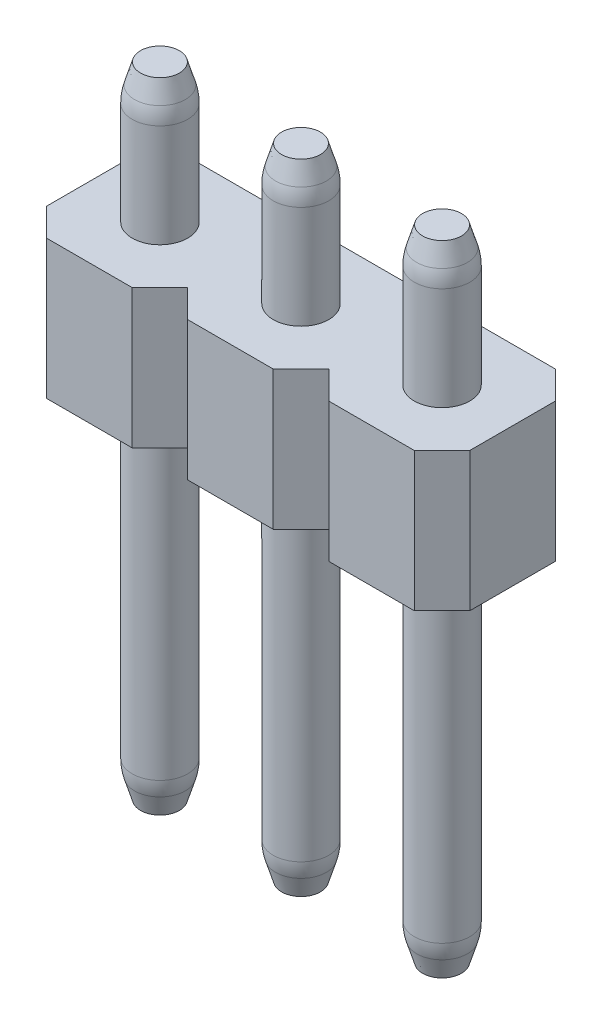
from build123d import *
from OCP.BRepFilletAPI import BRepFilletAPI_MakeChamfer

# Parameters (mm, degrees)
SKETCH1_R               = 0.5
BOSS_EXTRUDE1_DEPTH     = 11.5
BOSS_EXTRUDE1_2_DEPTH   = 11.5
BOSS_EXTRUDE1_3_DEPTH   = 11.5
BOSS_EXTRUDE1_4_DEPTH   = 11.5
BOSS_EXTRUDE1_5_DEPTH   = 11.5
BOSS_EXTRUDE1_6_DEPTH   = 11.5
BOSS_EXTRUDE1_7_DEPTH   = 11.5
BOSS_EXTRUDE1_8_DEPTH   = 11.5
BOSS_EXTRUDE1_9_DEPTH   = 11.5
BOSS_EXTRUDE1_10_DEPTH  = 11.5
BOSS_EXTRUDE1_11_DEPTH  = 11.5
BOSS_EXTRUDE1_12_DEPTH  = 11.5
BOSS_EXTRUDE1_13_DEPTH  = 11.5
BOSS_EXTRUDE1_14_DEPTH  = 11.5
BOSS_EXTRUDE1_15_DEPTH  = 11.5
BOSS_EXTRUDE1_16_DEPTH  = 11.5
BOSS_EXTRUDE2_DEPTH     = 2.5
CHAMFER1_SIZE           = 0.5
CHAMFER1_SIZE2          = 0.15
FILLET1_R               = 1
CHAMFER2_SIZE           = 0.15
CHAMFER2_SIZE2          = 0.5
FILLET2_R               = 1
CUT_EXTRUDE1_DEPTH      = 42.093776929
CUT_EXTRUDE1_DEPTH_BACK = 42.093776929


with BuildPart() as part:
    # Sketch1 → Boss-Extrude1 (new body)
    with BuildSketch(Plane(origin=(0, 0, 0), x_dir=(1, 0, 0), z_dir=(0, 1, 0))):
        Circle(SKETCH1_R)
    extrude(amount=BOSS_EXTRUDE1_DEPTH)



with BuildPart() as body_2:
    # Sketch1 → Boss-Extrude1 2 (new body)
    with BuildSketch(Plane(origin=(0, 0, 0), x_dir=(1, 0, 0), z_dir=(0, 1, 0))):
        with Locations((2.54, 0)):
            Circle(SKETCH1_R)
    extrude(amount=BOSS_EXTRUDE1_2_DEPTH)


with BuildPart() as body_3:
    # Sketch1 → Boss-Extrude1 3 (new body)
    with BuildSketch(Plane(origin=(0, 0, 0), x_dir=(1, 0, 0), z_dir=(0, 1, 0))):
        with Locations((5.08, 0)):
            Circle(SKETCH1_R)
    extrude(amount=BOSS_EXTRUDE1_3_DEPTH)


with BuildPart() as body_4:
    # Sketch1 → Boss-Extrude1 4 (new body)
    with BuildSketch(Plane(origin=(0, 0, 0), x_dir=(1, 0, 0), z_dir=(0, 1, 0))):
        with Locations((7.62, 0)):
            Circle(SKETCH1_R)
    extrude(amount=BOSS_EXTRUDE1_4_DEPTH)


with BuildPart() as body_5:
    # Sketch1 → Boss-Extrude1 5 (new body)
    with BuildSketch(Plane(origin=(0, 0, 0), x_dir=(1, 0, 0), z_dir=(0, 1, 0))):
        with Locations((10.16, 0)):
            Circle(SKETCH1_R)
    extrude(amount=BOSS_EXTRUDE1_5_DEPTH)


with BuildPart() as body_6:
    # Sketch1 → Boss-Extrude1 6 (new body)
    with BuildSketch(Plane(origin=(0, 0, 0), x_dir=(1, 0, 0), z_dir=(0, 1, 0))):
        with Locations((12.7, 0)):
            Circle(SKETCH1_R)
    extrude(amount=BOSS_EXTRUDE1_6_DEPTH)


with BuildPart() as body_7:
    # Sketch1 → Boss-Extrude1 7 (new body)
    with BuildSketch(Plane(origin=(0, 0, 0), x_dir=(1, 0, 0), z_dir=(0, 1, 0))):
        with Locations((15.24, 0)):
            Circle(SKETCH1_R)
    extrude(amount=BOSS_EXTRUDE1_7_DEPTH)


with BuildPart() as body_8:
    # Sketch1 → Boss-Extrude1 8 (new body)
    with BuildSketch(Plane(origin=(0, 0, 0), x_dir=(1, 0, 0), z_dir=(0, 1, 0))):
        with Locations((17.78, 0)):
            Circle(SKETCH1_R)
    extrude(amount=BOSS_EXTRUDE1_8_DEPTH)


with BuildPart() as body_9:
    # Sketch1 → Boss-Extrude1 9 (new body)
    with BuildSketch(Plane(origin=(0, 0, 0), x_dir=(1, 0, 0), z_dir=(0, 1, 0))):
        with Locations((20.32, 0)):
            Circle(SKETCH1_R)
    extrude(amount=BOSS_EXTRUDE1_9_DEPTH)


with BuildPart() as body_10:
    # Sketch1 → Boss-Extrude1 10 (new body)
    with BuildSketch(Plane(origin=(0, 0, 0), x_dir=(1, 0, 0), z_dir=(0, 1, 0))):
        with Locations((22.86, 0)):
            Circle(SKETCH1_R)
    extrude(amount=BOSS_EXTRUDE1_10_DEPTH)


with BuildPart() as body_11:
    # Sketch1 → Boss-Extrude1 11 (new body)
    with BuildSketch(Plane(origin=(0, 0, 0), x_dir=(1, 0, 0), z_dir=(0, 1, 0))):
        with Locations((25.4, 0)):
            Circle(SKETCH1_R)
    extrude(amount=BOSS_EXTRUDE1_11_DEPTH)


with BuildPart() as body_12:
    # Sketch1 → Boss-Extrude1 12 (new body)
    with BuildSketch(Plane(origin=(0, 0, 0), x_dir=(1, 0, 0), z_dir=(0, 1, 0))):
        with Locations((27.94, 0)):
            Circle(SKETCH1_R)
    extrude(amount=BOSS_EXTRUDE1_12_DEPTH)


with BuildPart() as body_13:
    # Sketch1 → Boss-Extrude1 13 (new body)
    with BuildSketch(Plane(origin=(0, 0, 0), x_dir=(1, 0, 0), z_dir=(0, 1, 0))):
        with Locations((30.48, 0)):
            Circle(SKETCH1_R)
    extrude(amount=BOSS_EXTRUDE1_13_DEPTH)


with BuildPart() as body_14:
    # Sketch1 → Boss-Extrude1 14 (new body)
    with BuildSketch(Plane(origin=(0, 0, 0), x_dir=(1, 0, 0), z_dir=(0, 1, 0))):
        with Locations((33.02, 0)):
            Circle(SKETCH1_R)
    extrude(amount=BOSS_EXTRUDE1_14_DEPTH)


with BuildPart() as body_15:
    # Sketch1 → Boss-Extrude1 15 (new body)
    with BuildSketch(Plane(origin=(0, 0, 0), x_dir=(1, 0, 0), z_dir=(0, 1, 0))):
        with Locations((35.56, 0)):
            Circle(SKETCH1_R)
    extrude(amount=BOSS_EXTRUDE1_15_DEPTH)


with BuildPart() as body_16:
    # Sketch1 → Boss-Extrude1 16 (new body)
    with BuildSketch(Plane(origin=(0, 0, 0), x_dir=(1, 0, 0), z_dir=(0, 1, 0))):
        with Locations((38.1, 0)):
            Circle(SKETCH1_R)
    extrude(amount=BOSS_EXTRUDE1_16_DEPTH)


with BuildPart() as part_1:
    add(part.part)

    add(body_2.part)  # Boss-Extrude2 merges body 2

    add(body_3.part)  # Boss-Extrude2 merges body 3

    add(body_4.part)  # Boss-Extrude2 merges body 4

    add(body_5.part)  # Boss-Extrude2 merges body 5

    add(body_6.part)  # Boss-Extrude2 merges body 6

    add(body_7.part)  # Boss-Extrude2 merges body 7

    add(body_8.part)  # Boss-Extrude2 merges body 8

    add(body_9.part)  # Boss-Extrude2 merges body 9

    add(body_10.part)  # Boss-Extrude2 merges body 10

    add(body_11.part)  # Boss-Extrude2 merges body 11

    add(body_12.part)  # Boss-Extrude2 merges body 12

    add(body_13.part)  # Boss-Extrude2 merges body 13

    add(body_14.part)  # Boss-Extrude2 merges body 14

    add(body_15.part)  # Boss-Extrude2 merges body 15

    add(body_16.part)  # Boss-Extrude2 merges body 16
    # Sketch2 → Boss-Extrude2 (add)
    with BuildSketch(Plane(origin=(0, 6.5, 0), x_dir=(1, 0, 0), z_dir=(0, 1, 0))):
        Polygon((-1.27, 0.77), (-0.77, 1.27), (0.77, 1.27), (1.27, 0.77), (1.77, 1.27), (3.31, 1.27), (3.81, 0.77), (4.31, 1.27), (5.85, 1.27), (6.35, 0.77), (6.85, 1.27), (8.39, 1.27), (8.89, 0.77), (9.39, 1.27), (10.93, 1.27), (11.43, 0.77), (11.93, 1.27), (13.47, 1.27), (13.97, 0.77), (14.47, 1.27), (16.01, 1.27), (16.51, 0.77), (17.01, 1.27), (18.55, 1.27), (19.05, 0.77), (19.55, 1.27), (21.09, 1.27), (21.59, 0.77), (22.09, 1.27), (23.63, 1.27), (24.13, 0.77), (24.63, 1.27), (26.17, 1.27), (26.67, 0.77), (27.17, 1.27), (28.71, 1.27), (29.21, 0.77), (29.71, 1.27), (31.25, 1.27), (31.75, 0.77), (32.25, 1.27), (33.79, 1.27), (34.29, 0.77), (34.79, 1.27), (36.33, 1.27), (36.83, 0.77), (37.33, 1.27), (38.87, 1.27), (39.37, 0.77), (39.37, -0.77), (38.87, -1.27), (37.33, -1.27), (36.83, -0.77), (36.33, -1.27), (34.79, -1.27), (34.29, -0.77), (33.79, -1.27), (32.25, -1.27), (31.75, -0.77), (31.25, -1.27), (29.71, -1.27), (29.21, -0.77), (28.71, -1.27), (27.17, -1.27), (26.67, -0.77), (26.17, -1.27), (24.63, -1.27), (24.13, -0.77), (23.63, -1.27), (22.09, -1.27), (21.59, -0.77), (21.09, -1.27), (19.55, -1.27), (19.05, -0.77), (18.55, -1.27), (17.01, -1.27), (16.51, -0.77), (16.01, -1.27), (14.47, -1.27), (13.97, -0.77), (13.47, -1.27), (11.93, -1.27), (11.43, -0.77), (10.93, -1.27), (9.39, -1.27), (8.89, -0.77), (8.39, -1.27), (6.85, -1.27), (6.35, -0.77), (5.85, -1.27), (4.31, -1.27), (3.81, -0.77), (3.31, -1.27), (1.77, -1.27), (1.27, -0.77), (0.77, -1.27), (-0.77, -1.27), (-1.27, -0.77), align=None)
    extrude(amount=BOSS_EXTRUDE2_DEPTH)

    # Chamfer1: one chamfer whose edges measure the first distance from different faces: ONE call of the kernel's chamfer builder (chamfer() names one face for all edges)
    chamfer1_edges_1 = [part_1.edges().sort_by_distance(p)[0] for p in [
        (14.74, 11.5, 0),
    ]]
    chamfer1_side_1 = [part_1.faces().sort_by_distance(p)[0] for p in [
        (14.74, 10.25, 0),
    ]]
    chamfer1_edges_2 = [part_1.edges().sort_by_distance(p)[0] for p in [
        (12.2, 11.5, 0),
    ]]
    chamfer1_side_2 = [part_1.faces().sort_by_distance(p)[0] for p in [
        (12.2, 10.25, 0),
    ]]
    chamfer1_edges_3 = [part_1.edges().sort_by_distance(p)[0] for p in [
        (9.66, 11.5, 0),
    ]]
    chamfer1_side_3 = [part_1.faces().sort_by_distance(p)[0] for p in [
        (9.66, 10.25, 0),
    ]]
    chamfer1_edges_4 = [part_1.edges().sort_by_distance(p)[0] for p in [
        (7.12, 11.5, 0),
    ]]
    chamfer1_side_4 = [part_1.faces().sort_by_distance(p)[0] for p in [
        (7.12, 10.25, 0),
    ]]
    chamfer1_edges_5 = [part_1.edges().sort_by_distance(p)[0] for p in [
        (4.58, 11.5, 0),
    ]]
    chamfer1_side_5 = [part_1.faces().sort_by_distance(p)[0] for p in [
        (4.58, 10.25, 0),
    ]]
    chamfer1_edges_6 = [part_1.edges().sort_by_distance(p)[0] for p in [
        (2.04, 11.5, 0),
    ]]
    chamfer1_side_6 = [part_1.faces().sort_by_distance(p)[0] for p in [
        (2.04, 10.25, 0),
    ]]
    chamfer1_edges_7 = [part_1.edges().sort_by_distance(p)[0] for p in [
        (-0.5, 11.5, 0),
    ]]
    chamfer1_side_7 = [part_1.faces().sort_by_distance(p)[0] for p in [
        (-0.5, 10.25, 0),
    ]]
    chamfer1_edges_8 = [part_1.edges().sort_by_distance(p)[0] for p in [
        (37.6, 11.5, 0),
    ]]
    chamfer1_side_8 = [part_1.faces().sort_by_distance(p)[0] for p in [
        (37.6, 10.25, 0),
    ]]
    chamfer1_edges_9 = [part_1.edges().sort_by_distance(p)[0] for p in [
        (35.06, 11.5, 0),
    ]]
    chamfer1_side_9 = [part_1.faces().sort_by_distance(p)[0] for p in [
        (35.06, 10.25, 0),
    ]]
    chamfer1_edges_10 = [part_1.edges().sort_by_distance(p)[0] for p in [
        (32.52, 11.5, 0),
    ]]
    chamfer1_side_10 = [part_1.faces().sort_by_distance(p)[0] for p in [
        (32.52, 10.25, 0),
    ]]
    chamfer1_edges_11 = [part_1.edges().sort_by_distance(p)[0] for p in [
        (29.98, 11.5, 0),
    ]]
    chamfer1_side_11 = [part_1.faces().sort_by_distance(p)[0] for p in [
        (29.98, 10.25, 0),
    ]]
    chamfer1_edges_12 = [part_1.edges().sort_by_distance(p)[0] for p in [
        (27.44, 11.5, 0),
    ]]
    chamfer1_side_12 = [part_1.faces().sort_by_distance(p)[0] for p in [
        (27.44, 10.25, 0),
    ]]
    chamfer1_edges_13 = [part_1.edges().sort_by_distance(p)[0] for p in [
        (24.9, 11.5, 0),
    ]]
    chamfer1_side_13 = [part_1.faces().sort_by_distance(p)[0] for p in [
        (24.9, 10.25, 0),
    ]]
    chamfer1_edges_14 = [part_1.edges().sort_by_distance(p)[0] for p in [
        (22.36, 11.5, 0),
    ]]
    chamfer1_side_14 = [part_1.faces().sort_by_distance(p)[0] for p in [
        (22.36, 10.25, 0),
    ]]
    chamfer1_edges_15 = [part_1.edges().sort_by_distance(p)[0] for p in [
        (19.82, 11.5, 0),
    ]]
    chamfer1_side_15 = [part_1.faces().sort_by_distance(p)[0] for p in [
        (19.82, 10.25, 0),
    ]]
    chamfer1_edges_16 = [part_1.edges().sort_by_distance(p)[0] for p in [
        (17.28, 11.5, 0),
    ]]
    chamfer1_side_16 = [part_1.faces().sort_by_distance(p)[0] for p in [
        (17.28, 10.25, 0),
    ]]
    chamfer1 = BRepFilletAPI_MakeChamfer(part_1.part.solid().wrapped)
    for e in chamfer1_edges_1:
        chamfer1.Add(CHAMFER1_SIZE, CHAMFER1_SIZE2, e.wrapped, chamfer1_side_1[0].wrapped)  # the first distance lies on this face
    for e in chamfer1_edges_2:
        chamfer1.Add(CHAMFER1_SIZE, CHAMFER1_SIZE2, e.wrapped, chamfer1_side_2[0].wrapped)  # the first distance lies on this face
    for e in chamfer1_edges_3:
        chamfer1.Add(CHAMFER1_SIZE, CHAMFER1_SIZE2, e.wrapped, chamfer1_side_3[0].wrapped)  # the first distance lies on this face
    for e in chamfer1_edges_4:
        chamfer1.Add(CHAMFER1_SIZE, CHAMFER1_SIZE2, e.wrapped, chamfer1_side_4[0].wrapped)  # the first distance lies on this face
    for e in chamfer1_edges_5:
        chamfer1.Add(CHAMFER1_SIZE, CHAMFER1_SIZE2, e.wrapped, chamfer1_side_5[0].wrapped)  # the first distance lies on this face
    for e in chamfer1_edges_6:
        chamfer1.Add(CHAMFER1_SIZE, CHAMFER1_SIZE2, e.wrapped, chamfer1_side_6[0].wrapped)  # the first distance lies on this face
    for e in chamfer1_edges_7:
        chamfer1.Add(CHAMFER1_SIZE, CHAMFER1_SIZE2, e.wrapped, chamfer1_side_7[0].wrapped)  # the first distance lies on this face
    for e in chamfer1_edges_8:
        chamfer1.Add(CHAMFER1_SIZE, CHAMFER1_SIZE2, e.wrapped, chamfer1_side_8[0].wrapped)  # the first distance lies on this face
    for e in chamfer1_edges_9:
        chamfer1.Add(CHAMFER1_SIZE, CHAMFER1_SIZE2, e.wrapped, chamfer1_side_9[0].wrapped)  # the first distance lies on this face
    for e in chamfer1_edges_10:
        chamfer1.Add(CHAMFER1_SIZE, CHAMFER1_SIZE2, e.wrapped, chamfer1_side_10[0].wrapped)  # the first distance lies on this face
    for e in chamfer1_edges_11:
        chamfer1.Add(CHAMFER1_SIZE, CHAMFER1_SIZE2, e.wrapped, chamfer1_side_11[0].wrapped)  # the first distance lies on this face
    for e in chamfer1_edges_12:
        chamfer1.Add(CHAMFER1_SIZE, CHAMFER1_SIZE2, e.wrapped, chamfer1_side_12[0].wrapped)  # the first distance lies on this face
    for e in chamfer1_edges_13:
        chamfer1.Add(CHAMFER1_SIZE, CHAMFER1_SIZE2, e.wrapped, chamfer1_side_13[0].wrapped)  # the first distance lies on this face
    for e in chamfer1_edges_14:
        chamfer1.Add(CHAMFER1_SIZE, CHAMFER1_SIZE2, e.wrapped, chamfer1_side_14[0].wrapped)  # the first distance lies on this face
    for e in chamfer1_edges_15:
        chamfer1.Add(CHAMFER1_SIZE, CHAMFER1_SIZE2, e.wrapped, chamfer1_side_15[0].wrapped)  # the first distance lies on this face
    for e in chamfer1_edges_16:
        chamfer1.Add(CHAMFER1_SIZE, CHAMFER1_SIZE2, e.wrapped, chamfer1_side_16[0].wrapped)  # the first distance lies on this face
    add(Compound.cast(chamfer1.Shape()), mode=Mode.REPLACE)

    # Fillet1
    fillet1_edges = [part_1.edges().sort_by_distance(p)[0] for p in [
        (37.6, 11, 0),
        (35.06, 11, 0),
        (32.52, 11, 0),
        (29.98, 11, 0),
        (27.44, 11, 0),
        (24.9, 11, 0),
        (22.36, 11, 0),
        (19.82, 11, 0),
        (17.28, 11, 0),
        (14.74, 11, 0),
        (12.2, 11, 0),
        (9.66, 11, 0),
        (7.12, 11, 0),
        (4.58, 11, 0),
        (2.04, 11, 0),
        (-0.5, 11, 0),
    ]]
    fillet(fillet1_edges, radius=FILLET1_R)

    # Chamfer2: one chamfer whose edges measure the first distance from different faces: ONE call of the kernel's chamfer builder (chamfer() names one face for all edges)
    chamfer2_edges_1 = [part_1.edges().sort_by_distance(p)[0] for p in [
        (9.66, 0, 0),
    ]]
    chamfer2_side_1 = [part_1.faces().sort_by_distance(p)[0] for p in [
        (10.16, 0, 0),
    ]]
    chamfer2_edges_2 = [part_1.edges().sort_by_distance(p)[0] for p in [
        (17.28, 0, 0),
    ]]
    chamfer2_side_2 = [part_1.faces().sort_by_distance(p)[0] for p in [
        (17.78, 0, 0),
    ]]
    chamfer2_edges_3 = [part_1.edges().sort_by_distance(p)[0] for p in [
        (22.36, 0, 0),
    ]]
    chamfer2_side_3 = [part_1.faces().sort_by_distance(p)[0] for p in [
        (22.86, 0, 0),
    ]]
    chamfer2_edges_4 = [part_1.edges().sort_by_distance(p)[0] for p in [
        (27.44, 0, 0),
    ]]
    chamfer2_side_4 = [part_1.faces().sort_by_distance(p)[0] for p in [
        (27.94, 0, 0),
    ]]
    chamfer2_edges_5 = [part_1.edges().sort_by_distance(p)[0] for p in [
        (29.98, 0, 0),
    ]]
    chamfer2_side_5 = [part_1.faces().sort_by_distance(p)[0] for p in [
        (30.48, 0, 0),
    ]]
    chamfer2_edges_6 = [part_1.edges().sort_by_distance(p)[0] for p in [
        (-0.5, 0, 0),
    ]]
    chamfer2_side_6 = [part_1.faces().sort_by_distance(p)[0] for p in [
        (0, 0, 0),
    ]]
    chamfer2_edges_7 = [part_1.edges().sort_by_distance(p)[0] for p in [
        (2.04, 0, 0),
    ]]
    chamfer2_side_7 = [part_1.faces().sort_by_distance(p)[0] for p in [
        (2.54, 0, 0),
    ]]
    chamfer2_edges_8 = [part_1.edges().sort_by_distance(p)[0] for p in [
        (4.58, 0, 0),
    ]]
    chamfer2_side_8 = [part_1.faces().sort_by_distance(p)[0] for p in [
        (5.08, 0, 0),
    ]]
    chamfer2_edges_9 = [part_1.edges().sort_by_distance(p)[0] for p in [
        (7.12, 0, 0),
    ]]
    chamfer2_side_9 = [part_1.faces().sort_by_distance(p)[0] for p in [
        (7.62, 0, 0),
    ]]
    chamfer2_edges_10 = [part_1.edges().sort_by_distance(p)[0] for p in [
        (12.2, 0, 0),
    ]]
    chamfer2_side_10 = [part_1.faces().sort_by_distance(p)[0] for p in [
        (12.7, 0, 0),
    ]]
    chamfer2_edges_11 = [part_1.edges().sort_by_distance(p)[0] for p in [
        (14.74, 0, 0),
    ]]
    chamfer2_side_11 = [part_1.faces().sort_by_distance(p)[0] for p in [
        (15.24, 0, 0),
    ]]
    chamfer2_edges_12 = [part_1.edges().sort_by_distance(p)[0] for p in [
        (19.82, 0, 0),
    ]]
    chamfer2_side_12 = [part_1.faces().sort_by_distance(p)[0] for p in [
        (20.32, 0, 0),
    ]]
    chamfer2_edges_13 = [part_1.edges().sort_by_distance(p)[0] for p in [
        (24.9, 0, 0),
    ]]
    chamfer2_side_13 = [part_1.faces().sort_by_distance(p)[0] for p in [
        (25.4, 0, 0),
    ]]
    chamfer2_edges_14 = [part_1.edges().sort_by_distance(p)[0] for p in [
        (32.52, 0, 0),
    ]]
    chamfer2_side_14 = [part_1.faces().sort_by_distance(p)[0] for p in [
        (33.02, 0, 0),
    ]]
    chamfer2_edges_15 = [part_1.edges().sort_by_distance(p)[0] for p in [
        (35.06, 0, 0),
    ]]
    chamfer2_side_15 = [part_1.faces().sort_by_distance(p)[0] for p in [
        (35.56, 0, 0),
    ]]
    chamfer2_edges_16 = [part_1.edges().sort_by_distance(p)[0] for p in [
        (37.6, 0, 0),
    ]]
    chamfer2_side_16 = [part_1.faces().sort_by_distance(p)[0] for p in [
        (38.1, 0, 0),
    ]]
    chamfer2 = BRepFilletAPI_MakeChamfer(part_1.part.solid().wrapped)
    for e in chamfer2_edges_1:
        chamfer2.Add(CHAMFER2_SIZE, CHAMFER2_SIZE2, e.wrapped, chamfer2_side_1[0].wrapped)  # the first distance lies on this face
    for e in chamfer2_edges_2:
        chamfer2.Add(CHAMFER2_SIZE, CHAMFER2_SIZE2, e.wrapped, chamfer2_side_2[0].wrapped)  # the first distance lies on this face
    for e in chamfer2_edges_3:
        chamfer2.Add(CHAMFER2_SIZE, CHAMFER2_SIZE2, e.wrapped, chamfer2_side_3[0].wrapped)  # the first distance lies on this face
    for e in chamfer2_edges_4:
        chamfer2.Add(CHAMFER2_SIZE, CHAMFER2_SIZE2, e.wrapped, chamfer2_side_4[0].wrapped)  # the first distance lies on this face
    for e in chamfer2_edges_5:
        chamfer2.Add(CHAMFER2_SIZE, CHAMFER2_SIZE2, e.wrapped, chamfer2_side_5[0].wrapped)  # the first distance lies on this face
    for e in chamfer2_edges_6:
        chamfer2.Add(CHAMFER2_SIZE, CHAMFER2_SIZE2, e.wrapped, chamfer2_side_6[0].wrapped)  # the first distance lies on this face
    for e in chamfer2_edges_7:
        chamfer2.Add(CHAMFER2_SIZE, CHAMFER2_SIZE2, e.wrapped, chamfer2_side_7[0].wrapped)  # the first distance lies on this face
    for e in chamfer2_edges_8:
        chamfer2.Add(CHAMFER2_SIZE, CHAMFER2_SIZE2, e.wrapped, chamfer2_side_8[0].wrapped)  # the first distance lies on this face
    for e in chamfer2_edges_9:
        chamfer2.Add(CHAMFER2_SIZE, CHAMFER2_SIZE2, e.wrapped, chamfer2_side_9[0].wrapped)  # the first distance lies on this face
    for e in chamfer2_edges_10:
        chamfer2.Add(CHAMFER2_SIZE, CHAMFER2_SIZE2, e.wrapped, chamfer2_side_10[0].wrapped)  # the first distance lies on this face
    for e in chamfer2_edges_11:
        chamfer2.Add(CHAMFER2_SIZE, CHAMFER2_SIZE2, e.wrapped, chamfer2_side_11[0].wrapped)  # the first distance lies on this face
    for e in chamfer2_edges_12:
        chamfer2.Add(CHAMFER2_SIZE, CHAMFER2_SIZE2, e.wrapped, chamfer2_side_12[0].wrapped)  # the first distance lies on this face
    for e in chamfer2_edges_13:
        chamfer2.Add(CHAMFER2_SIZE, CHAMFER2_SIZE2, e.wrapped, chamfer2_side_13[0].wrapped)  # the first distance lies on this face
    for e in chamfer2_edges_14:
        chamfer2.Add(CHAMFER2_SIZE, CHAMFER2_SIZE2, e.wrapped, chamfer2_side_14[0].wrapped)  # the first distance lies on this face
    for e in chamfer2_edges_15:
        chamfer2.Add(CHAMFER2_SIZE, CHAMFER2_SIZE2, e.wrapped, chamfer2_side_15[0].wrapped)  # the first distance lies on this face
    for e in chamfer2_edges_16:
        chamfer2.Add(CHAMFER2_SIZE, CHAMFER2_SIZE2, e.wrapped, chamfer2_side_16[0].wrapped)  # the first distance lies on this face
    add(Compound.cast(chamfer2.Shape()), mode=Mode.REPLACE)

    # Fillet2
    fillet2_edges = [part_1.edges().sort_by_distance(p)[0] for p in [
        (29.98, 0.5, 0),
        (32.52, 0.5, 0),
        (35.06, 0.5, 0),
        (37.6, 0.5, 0),
        (27.44, 0.5, 0),
        (24.9, 0.5, 0),
        (22.36, 0.5, 0),
        (19.82, 0.5, 0),
        (17.28, 0.5, 0),
        (14.74, 0.5, 0),
        (12.2, 0.5, 0),
        (9.66, 0.5, 0),
        (7.12, 0.5, 0),
        (4.58, 0.5, 0),
        (2.04, 0.5, 0),
        (-0.5, 0.5, 0),
    ]]
    fillet(fillet2_edges, radius=FILLET2_R)

    # Sketch3 → Cut-Extrude1 (cut, two sides: drawn at the far end of the back side and taken through both)
    with BuildSketch(Plane(origin=(0, 0, -1.27), x_dir=(-1, 0, 0), z_dir=(0, 0, -1)).offset(-CUT_EXTRUDE1_DEPTH_BACK)):
        Polygon((-31.75, 11.5), (-31.75, 0), (-40.282511818, 0), (-40.282511818, 14.702627998), align=None)
        Polygon((-24.13, 11.5), (-24.13, 0), (2.40719131, -1.427988579), (2.361545608, 11.5), align=None)
    extrude(amount=CUT_EXTRUDE1_DEPTH + CUT_EXTRUDE1_DEPTH_BACK, mode=Mode.SUBTRACT)


solid = part_1.part
